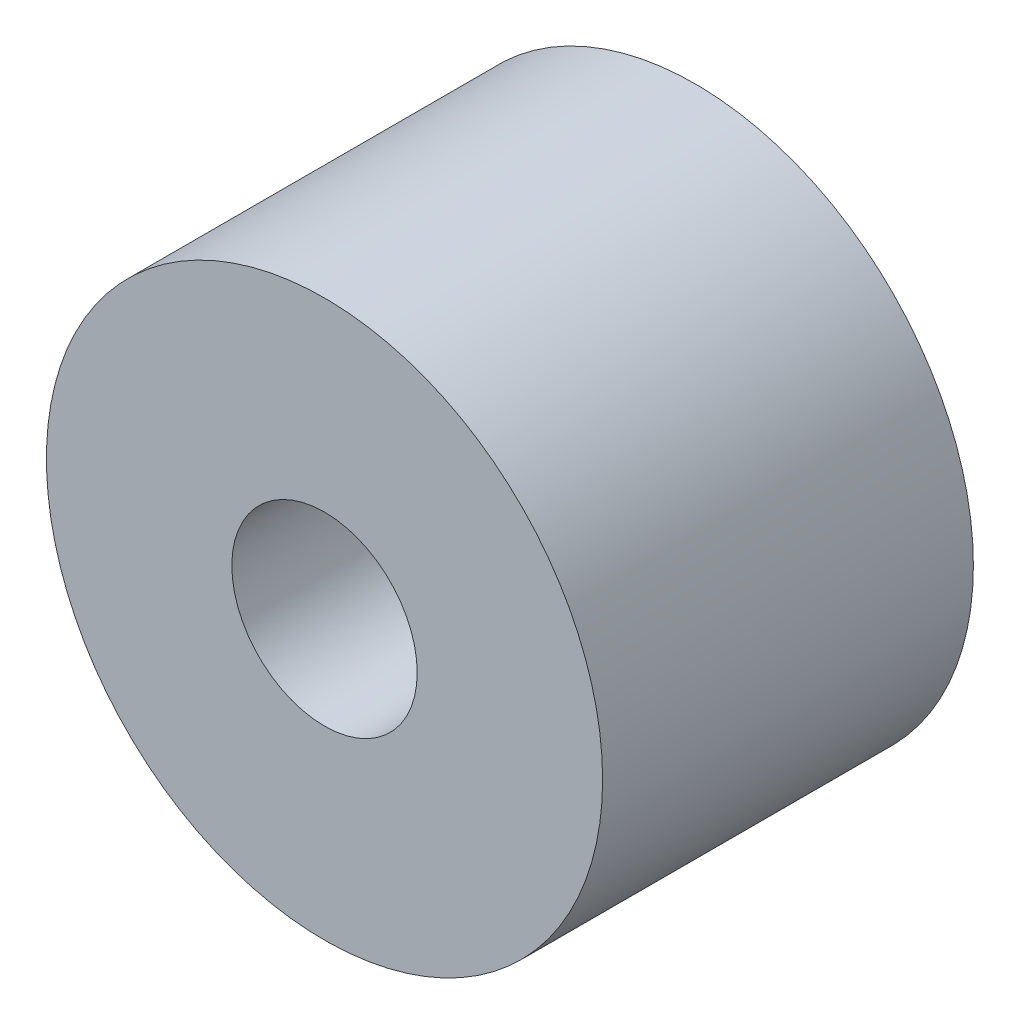
from build123d import *

# Parameters (mm, degrees)
SKETCH1_R           = 15
SKETCH1_R_2         = 5
BOSS_EXTRUDE1_DEPTH = 20


with BuildPart() as part:
    # Sketch1 → Boss-Extrude1 (new body)
    with BuildSketch(Plane.XY):
        Circle(SKETCH1_R)
        Circle(SKETCH1_R_2, mode=Mode.SUBTRACT)
    extrude(amount=BOSS_EXTRUDE1_DEPTH)


solid = part.part
